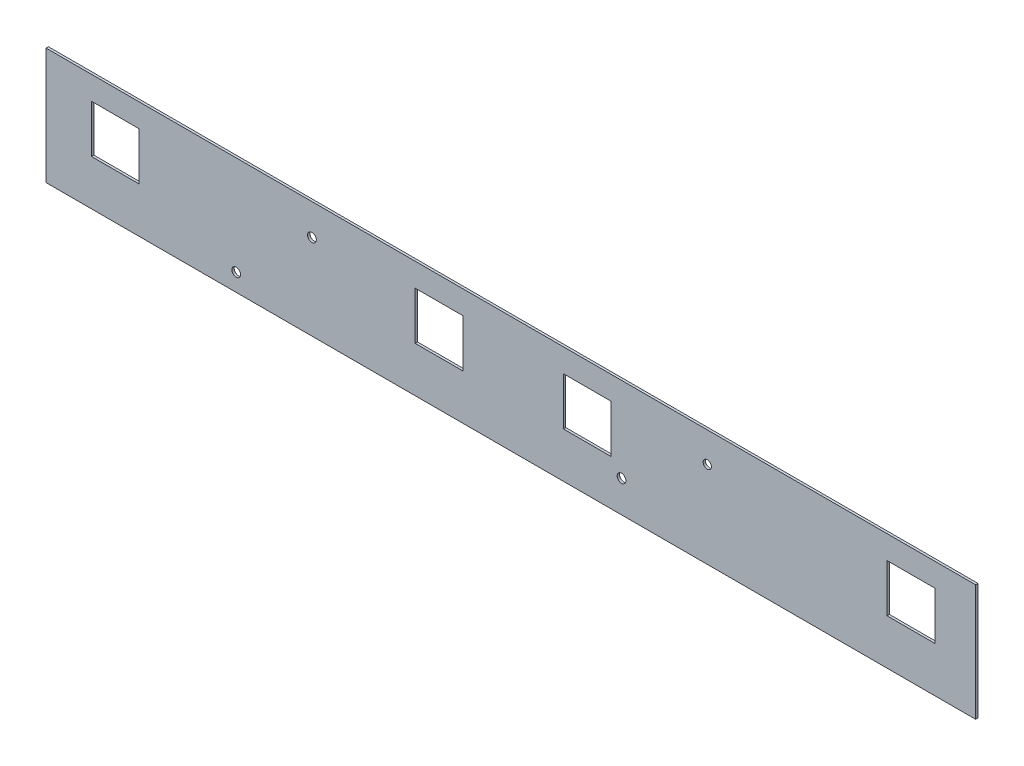
from build123d import *

# Parameters (mm, degrees)
SKETCH1_W          = 623.55984
SKETCH1_H          = 78.16342
BASE_FLANGE1_DEPTH = 1.5875
SKETCH3_R          = 2.75
SKETCH3_R_2        = 2.921
SKETCH3_W          = 32.08
SKETCH3_H          = 32.08
CUT_EXTRUDE3_DEPTH = 389.990867909


# Sheet-metal steps are written as plain solids
with BuildPart() as part:
    # Sketch1 → Base-Flange1 (new body)
    with BuildSketch(Plane.XY):
        with Locations((-38.857061865, -129.337653818)):
            Rectangle(SKETCH1_W, SKETCH1_H)
    extrude(amount=-BASE_FLANGE1_DEPTH)

    # Sketch3 → Cut-Extrude3 (cut, through all)
    with BuildSketch(Plane.XY):
        with Locations((92.914515529, -110.369060902)):
            Circle(SKETCH3_R)
        with Locations((35.391947046, -147.147547142)):
            Circle(SKETCH3_R_2)
        with Locations((-172.247688202, -111.060995593)):
            Circle(SKETCH3_R_2)
        with Locations((-223.059163384, -156.664689794)):
            Circle(SKETCH3_R_2)
        with Locations((-304.149901865, -121.952427932)):
            Rectangle(SKETCH3_W, SKETCH3_H)
        with Locations((-86.931641865, -121.952427932)):
            Rectangle(SKETCH3_W, SKETCH3_H)
        with Locations((12.392518135, -121.952427932)):
            Rectangle(SKETCH3_W, SKETCH3_H)
        with Locations((229.610778135, -121.952427932)):
            Rectangle(SKETCH3_W, SKETCH3_H)
    extrude(amount=-CUT_EXTRUDE3_DEPTH, mode=Mode.SUBTRACT)


solid = part.part
